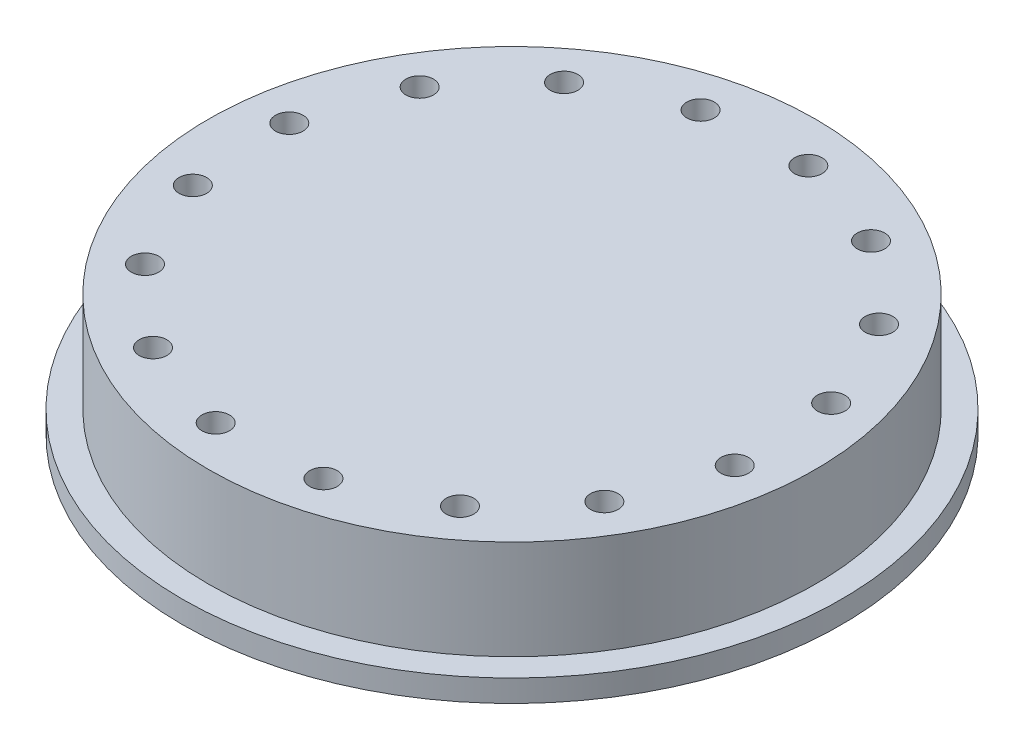
from build123d import *

# Parameters (mm, degrees)
SKETCH1_R               = 29.86111111
BOSS_EXTRUDE1_DEPTH     = 1
SKETCH2_R               = 27.5
BOSS_EXTRUDE2_DEPTH     = 9
CUT_EXTRUDE1_DEPTH      = 44.639109907
CUT_EXTRUDE1_DEPTH_BACK = 44.639109907
SKETCH3_R               = 1.25


with BuildPart() as part:
    # Sketch1 → Boss-Extrude1 (new, symmetric)
    with BuildSketch(Plane(origin=(0, 0, 0), x_dir=(1, 0, 0), z_dir=(0, 1, 0))):
        Circle(SKETCH1_R)
    extrude(amount=BOSS_EXTRUDE1_DEPTH, both=True)

    # Sketch2 → Boss-Extrude2 (add)
    with BuildSketch(Plane(origin=(0, 1, 0), x_dir=(1, 0, 0), z_dir=(0, 1, 0))):
        Circle(SKETCH2_R)
    extrude(amount=BOSS_EXTRUDE2_DEPTH)

    # Sketch3 → Cut-Extrude1 (cut, two sides: drawn at the far end of the back side and taken through both)
    with BuildSketch(Plane.XZ.offset(1).offset(-CUT_EXTRUDE1_DEPTH_BACK)):
        with Locations((23.000954051, -5.917652637)):
            Circle(SKETCH3_R)
        with Locations((23.514698299, 3.334885892)):
            Circle(SKETCH3_R)
        with Locations((20.448542892, 12.079718275)):
            Circle(SKETCH3_R)
        with Locations((14.269282196, 18.985523054)):
            Circle(SKETCH3_R)
        with Locations((18.985523054, -14.269282196)):
            Circle(SKETCH3_R)
        with Locations((5.917652637, 23.000954051)):
            Circle(SKETCH3_R)
        with Locations((-3.334885892, 23.514698299)):
            Circle(SKETCH3_R)
        with Locations((-12.079718275, 20.448542892)):
            Circle(SKETCH3_R)
        with Locations((-18.985523054, 14.269282196)):
            Circle(SKETCH3_R)
        with Locations((-23.000954051, 5.917652637)):
            Circle(SKETCH3_R)
        with Locations((-23.514698299, -3.334885892)):
            Circle(SKETCH3_R)
        with Locations((12.079718275, -20.448542892)):
            Circle(SKETCH3_R)
        with Locations((3.334885892, -23.514698299)):
            Circle(SKETCH3_R)
        with Locations((-5.917652637, -23.000954051)):
            Circle(SKETCH3_R)
        with Locations((-14.269282196, -18.985523054)):
            Circle(SKETCH3_R)
        with Locations((-20.448542892, -12.079718275)):
            Circle(SKETCH3_R)
    extrude(amount=CUT_EXTRUDE1_DEPTH + CUT_EXTRUDE1_DEPTH_BACK, mode=Mode.SUBTRACT)


solid = part.part
